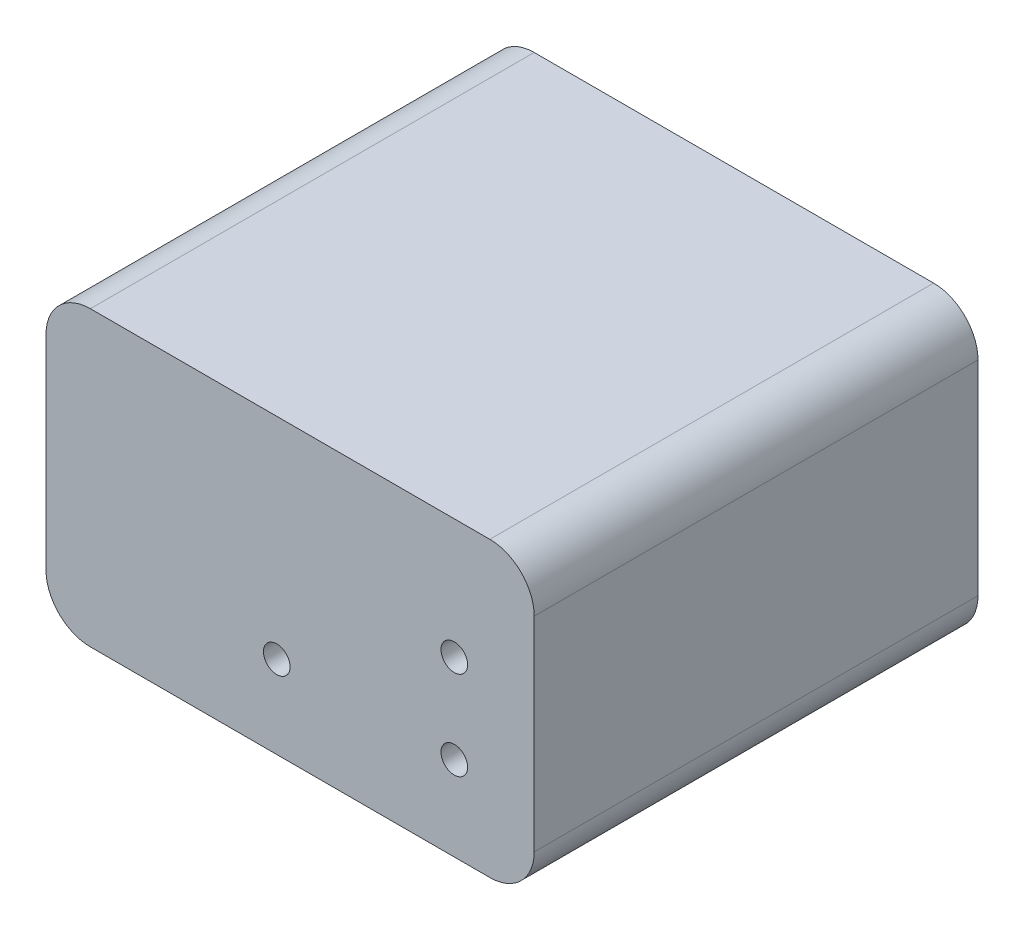
from build123d import *

# Parameters (mm, degrees)
ESQUISSE1_W             = 55
ESQUISSE1_H             = 33
BOSS_EXTRU_1_DEPTH      = 50
ENL_V_MAT_EXTRU_2_DEPTH = 45
CONG_1_R                = 5
ESQUISSE3_R             = 1.5
ENL_V_MAT_EXTRU_3_DEPTH = 10
ENL_V_MAT_EXTRU_4_DEPTH = 2


with BuildPart() as part:
    # Esquisse1 → Boss.-Extru.1 (new body)
    with BuildSketch(Plane.XY):
        with Locations((-27.5, 16.5)):
            Rectangle(ESQUISSE1_W, ESQUISSE1_H)
    extrude(amount=BOSS_EXTRU_1_DEPTH)

    # Esquisse2 → Enlèv. mat.-Extru.2 (cut)
    with BuildSketch(Plane.XY):
        with BuildLine():
            Line((-39, 29), (-16, 29))
            ThreePointArc((-16, 29), (-3, 16), (-16, 3))
            Line((-16, 3), (-39, 3))
            ThreePointArc((-39, 3), (-52, 16), (-39, 29))
        make_face()
    extrude(amount=ENL_V_MAT_EXTRU_2_DEPTH, mode=Mode.SUBTRACT)

    # Congé1
    cong_1_edges = [part.edges().sort_by_distance(p)[0] for p in [
        (-55, 33, 25),
        (-55, 0, 25),
        (0, 0, 25),
        (0, 33, 25),
    ]]
    fillet(cong_1_edges, radius=CONG_1_R)

    # Esquisse3 → Enlèv. mat.-Extru.3 (cut)
    with BuildSketch(Plane.XY.offset(50)):
        with Locations((-29, 9.3)):
            Circle(ESQUISSE3_R)
        with Locations((-9, 19.5)):
            Circle(ESQUISSE3_R)
        with Locations((-9, 9.5)):
            Circle(ESQUISSE3_R)
    extrude(amount=-ENL_V_MAT_EXTRU_3_DEPTH, mode=Mode.SUBTRACT)

    # Esquisse4 → Enlèv. mat.-Extru.4 (cut)
    with BuildSketch(Plane(origin=(0, 0, 45), x_dir=(-1, 0, 0), z_dir=(0, 0, -1))):
        Polygon((27.354551733, 6.45), (30.645448267, 6.45), (32.290896534, 9.3), (30.645448267, 12.15), (27.354551733, 12.15), (25.709103466, 9.3), align=None)
        Polygon((7.354551733, 6.65), (10.645448267, 6.65), (12.290896534, 9.5), (10.645448267, 12.35), (7.354551733, 12.35), (5.709103466, 9.5), align=None)
        Polygon((7.354551733, 16.65), (10.645448267, 16.65), (12.290896534, 19.5), (10.645448267, 22.35), (7.354551733, 22.35), (5.709103466, 19.5), align=None)
    extrude(amount=-ENL_V_MAT_EXTRU_4_DEPTH, mode=Mode.SUBTRACT)


solid = part.part
